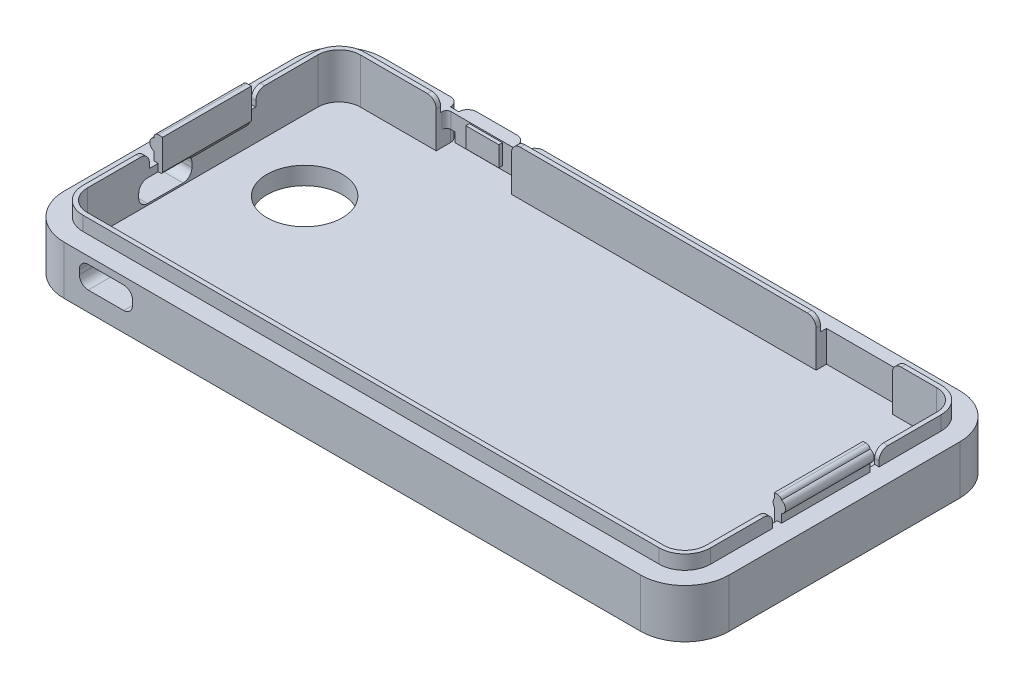
from build123d import *

# Parameters (mm, degrees)
EXTRUDE_2_DEPTH       = 5.5
EXTRUDE_4_DEPTH       = 1.6
SKETCH_7_W            = 0.5
SKETCH_7_H            = 10
EXTRUDE_8_DEPTH       = 2.8
SKETCH_8_R            = 0.7
EXTRUDE_9_DEPTH       = 10
FILLET_1_R            = 0.5
SKETCH_11_W           = 1
SKETCH_11_H           = 1.6
CUT_EXTRUDE_1_DEPTH   = 1.2
FILLET_2_R            = 1
SKETCH_13_W           = 0.5
SKETCH_13_H           = 10
EXTRUDE_10_DEPTH      = 2.8
CUT_EXTRUDE_START     = -3.5
CUT_EXTRUDE_2_DEPTH   = 3.5
SKETCH_13_2_W         = 0.5
SKETCH_13_2_H         = 10
EXTRUDE_11_DEPTH      = 2
EXTRUDE_12_DEPTH      = 1.6
EXTRUDE_12_DEPTH_BACK = 2
SKETCH_5_W            = 0.3
SKETCH_5_H            = 10
SKETCH_17_W           = 0.5
SKETCH_17_H           = 1
CUT_EXTRUDE_3_DEPTH   = 1.6
SKETCH_19_W           = 0.8
SKETCH_19_H           = 10
EXTRUDE_15_DEPTH      = 1
SKETCH_20_R           = 0.7
EXTRUDE_16_DEPTH      = 10
FILLET_4_R            = 0.5
CHAMFER_11_SIZE       = 1
CHAMFER_11_SIZE_2     = 1.37638192
FILLET_5_R            = 1
CUT_EXTRUDE_17_REACH  = 45.451
SKETCH_33_R           = 4.25
SKETCH_44_W           = 0.815007944
SKETCH_44_H           = 4.866639491
CUT_EXTRUDE_19_DEPTH  = 0.5
CUT_EXTRUDE_20_REACH  = 55.751
SKETCH_45_W           = 6
SKETCH_45_H           = 2.5
FILLET_12_R           = 1
SKETCH_46_W           = 8.5
SKETCH_46_H           = 1.2
SKETCH_46_W_2         = 8.6
CUT_EXTRUDE_21_DEPTH  = 5.1
FILLET_13_R           = 1
CUT_EXTRUDE_22_REACH  = 55.751
SKETCH_51_W           = 0.953732737
SKETCH_51_H           = 1.75
CUT_EXTRUDE_23_DEPTH  = 1
FILLET_14_R           = 1
SKETCH_52_W           = 3.721904065
SKETCH_52_H           = 2.260969759
EXTRUDE_18_DEPTH      = 0.4
FILLET_15_R           = 0.5
CUT_EXTRUDE_24_REACH  = 79.575
SKETCH_53_W           = 6
SKETCH_53_H           = 2.5
FILLET_16_R           = 1


# Some blends are built 0.0001 mm under size
with BuildPart() as part:
    # case 2 → 凸台-拉伸2 (new body)
    with BuildSketch(Plane(origin=(0, 0, 0), x_dir=(1, 0, 0), z_dir=(0, 1, 0))):
        with BuildLine():
            Line((-34.042196447, 18), (30.957803553, 18))
            ThreePointArc((30.957803553, 18), (34.493337459, 16.535533906), (35.957803553, 13))
            Line((35.957803553, 13), (35.957803553, -13))
            ThreePointArc((35.957803553, -13), (34.493337459, -16.535533906), (30.957803553, -18))
            Line((30.957803553, -18), (-34.042196447, -18))
            ThreePointArc((-34.042196447, -18), (-37.577730353, -16.535533906), (-39.042196447, -13))
            Line((-39.042196447, -13), (-39.042196447, 13))
            ThreePointArc((-39.042196447, 13), (-37.577730353, 16.535533906), (-34.042196447, 18))
        make_face()
    extrude(amount=EXTRUDE_2_DEPTH)

    # 草图3 → 凸台-拉伸4 (add)
    with BuildSketch(Plane(origin=(0, 5.5, 0), x_dir=(1, 0, 0), z_dir=(0, 1, 0))):
        with BuildLine():
            Line((-36.942196447, 13), (-36.942196447, -13))
            ThreePointArc((-36.942196447, -13), (-36.092806113, -15.050609665), (-34.042196447, -15.9))
            Line((-34.042196447, -15.9), (30.957803553, -15.9))
            ThreePointArc((30.957803553, -15.9), (33.008413218, -15.050609665), (33.857803553, -13))
            Line((33.857803553, -13), (33.857803553, 13))
            ThreePointArc((33.857803553, 13), (33.008413218, 15.050609665), (30.957803553, 15.9))
            Line((30.957803553, 15.9), (-34.042196447, 15.9))
            ThreePointArc((-34.042196447, 15.9), (-36.092806113, 15.050609665), (-36.942196447, 13))
        make_face()
        with BuildLine():
            Line((-34.042196447, -15.4), (30.957803553, -15.4))
            ThreePointArc((30.957803553, -15.4), (32.654859828, -14.697056275), (33.357803553, -13))
            Line((33.357803553, -13), (33.357803553, 13))
            ThreePointArc((33.357803553, 13), (32.654859828, 14.697056275), (30.957803553, 15.4))
            Line((30.957803553, 15.4), (-34.042196447, 15.4))
            ThreePointArc((-34.042196447, 15.4), (-35.739252722, 14.697056275), (-36.442196447, 13))
            Line((-36.442196447, 13), (-36.442196447, -13))
            ThreePointArc((-36.442196447, -13), (-35.739252722, -14.697056275), (-34.042196447, -15.4))
        make_face(mode=Mode.SUBTRACT)
    extrude(amount=EXTRUDE_4_DEPTH)

    # 草图7 → 凸台-拉伸8 (add)
    with BuildSketch(Plane(origin=(0, 5.5, 0), x_dir=(1, 0, 0), z_dir=(0, 1, 0))):
        with Locations((-36.692196447, 0)):
            Rectangle(SKETCH_7_W, SKETCH_7_H)
    extrude(amount=EXTRUDE_8_DEPTH)

    # 草图8 → 凸台-拉伸9 (add)
    with BuildSketch(Plane.XY.offset(5)):
        with Locations((-36.692196447, 7.1)):
            Circle(SKETCH_8_R)
    extrude(amount=-EXTRUDE_9_DEPTH)

    # 圆角1
    fillet_1_edges = [part.edges().sort_by_distance(p)[0] for p in [
        (-36.942196447, 8.3, 0),
    ]]
    fillet(fillet_1_edges, radius=FILLET_1_R - 0.0001)  # a hair under: the kernel refuses the full size

    # 草图11 → 切除-拉伸1 (cut)
    with BuildSketch(Plane.ZY.offset(36.942196447)):
        with Locations((5.5, 6.3)):
            Rectangle(SKETCH_11_W, SKETCH_11_H)
        with Locations((-5.5, 6.3)):
            Rectangle(SKETCH_11_W, SKETCH_11_H)
    extrude(amount=-CUT_EXTRUDE_1_DEPTH, mode=Mode.SUBTRACT)

    # 圆角2
    fillet_2_edges = [part.edges().sort_by_distance(p)[0] for p in [
        (-36.692196447, 7.1, 6),
        (-36.692196447, 7.1, -6),
    ]]
    fillet(fillet_2_edges, radius=FILLET_2_R)

    # 草图13 → 凸台-拉伸10 (add)
    with BuildSketch(Plane(origin=(0, 5.5, 0), x_dir=(1, 0, 0), z_dir=(0, 1, 0))):
        with Locations((-36.192196447, 0)):
            Rectangle(SKETCH_13_W, SKETCH_13_H)
    extrude(amount=EXTRUDE_10_DEPTH)

    # 草图14 → 切除-拉伸2 (cut)
    with BuildSketch(Plane(origin=(0, 5.5, 0), x_dir=(1, 0, 0), z_dir=(0, 1, 0)).offset(CUT_EXTRUDE_START)):
        with BuildLine():
            Line((-34.042196447, -15.4), (30.957803553, -15.4))
            ThreePointArc((30.957803553, -15.4), (32.654859828, -14.697056275), (33.357803553, -13))
            Line((33.357803553, -13), (33.357803553, 13))
            ThreePointArc((33.357803553, 13), (32.654859828, 14.697056275), (30.957803553, 15.4))
            Line((30.957803553, 15.4), (-34.042196447, 15.4))
            ThreePointArc((-34.042196447, 15.4), (-35.739252722, 14.697056275), (-36.442196447, 13))
            Line((-36.442196447, 13), (-36.442196447, -13))
            ThreePointArc((-36.442196447, -13), (-35.739252722, -14.697056275), (-34.042196447, -15.4))
        make_face()
    extrude(amount=CUT_EXTRUDE_2_DEPTH, mode=Mode.SUBTRACT)

    # 草图13<2> → 凸台-拉伸11 (add)
    with BuildSketch(Plane(origin=(0, 5.5, 0), x_dir=(1, 0, 0), z_dir=(0, 1, 0))):
        with Locations((-36.192196447, 0)):
            Rectangle(SKETCH_13_2_W, SKETCH_13_2_H)
    extrude(amount=-EXTRUDE_11_DEPTH)

    # 草图5 → 凸台-拉伸12 (add, two sides: drawn at the far end of the back side and taken through both)
    with BuildSketch(Plane(origin=(0, 5.5, 0), x_dir=(1, 0, 0), z_dir=(0, 1, 0)).offset(-EXTRUDE_12_DEPTH_BACK)):
        with Locations((33.207803553, 0)):
            Rectangle(SKETCH_5_W, SKETCH_5_H)
    extrude(amount=EXTRUDE_12_DEPTH + EXTRUDE_12_DEPTH_BACK)

    # 草图17 → 切除-拉伸3 (cut)
    with BuildSketch(Plane(origin=(0, 7.1, 0), x_dir=(1, 0, 0), z_dir=(0, 1, 0))):
        with Locations((33.607803553, -5.5)):
            Rectangle(SKETCH_17_W, SKETCH_17_H)
        with Locations((33.607803553, 5.5)):
            Rectangle(SKETCH_17_W, SKETCH_17_H)
    extrude(amount=-CUT_EXTRUDE_3_DEPTH, mode=Mode.SUBTRACT)

    # 草图19 → 凸台-拉伸15 (add)
    with BuildSketch(Plane(origin=(0, 7.1, 0), x_dir=(1, 0, 0), z_dir=(0, 1, 0))):
        with Locations((33.457803553, 0)):
            Rectangle(SKETCH_19_W, SKETCH_19_H)
    extrude(amount=EXTRUDE_15_DEPTH)

    # 草图20 → 凸台-拉伸16 (add)
    with BuildSketch(Plane(origin=(0, 0, -5), x_dir=(-1, 0, 0), z_dir=(0, 0, -1))):
        with Locations((-33.607803553, 7.1)):
            Circle(SKETCH_20_R)
    extrude(amount=-EXTRUDE_16_DEPTH)

    # 圆角4
    # the kernel refuses this fillet: 0.5 mm, written as the material it takes off along each edge
    with BuildSketch(Plane(origin=(33.857803553, 8.1, -6.189366537), x_dir=(-1, 0, 0), z_dir=(0, 0, 1))) as fillet_4_piece_1:
        with BuildLine():
            CenterArc((0.475746615, 0.5), FILLET_4_R, 197.918850754, 72.081149246)
            Line((0, 0.346165158), (-0.009514932, 0.343088462))
            ThreePointArc((-0.009514932, 0.343088462), (-0.01, 0.173082579), (-0.01, 0))
            Line((-0.01, 0), (0, -0.01))
            Line((0, -0.01), (0.475746615, -0.01))
            Line((0.475746615, -0.01), (0.475746615, 0))
        make_face()
    extrude(amount=12.378733074, mode=Mode.SUBTRACT)

    # 倒角11
    # the kernel refuses this chamfer: 1.37638192, 1 mm, written as the material it takes off along each edge
    with BuildSketch(Plane(origin=(-35.942196447, 3.5, 8.553227563), x_dir=(-0.9990705747005859, -0.04310437063037643, 0), z_dir=(0, 0, -1))) as chamfer_11_piece_1_section:
        Polygon((CHAMFER_11_SIZE * 0.999070574701, CHAMFER_11_SIZE * 0.0431043706304), (-CHAMFER_11_SIZE_2 * 0.0431043706451, CHAMFER_11_SIZE_2 * 0.999070575043), (0, 0), align=None)
    chamfer_11_piece_1 = extrude(amount=17.106455125, mode=Mode.PRIVATE)
    chamfer_11_piece_1 = split(chamfer_11_piece_1, bisect_by=Plane(origin=(-36.442196447, 4.046250957, 0), z_dir=(1, 0, 0)), keep=Keep.TOP, mode=Mode.PRIVATE)
    add(chamfer_11_piece_1, mode=Mode.SUBTRACT)

    # 圆角5
    fillet_5_edges = [part.edges().sort_by_distance(p)[0] for p in [
        (33.607803553, 7.1, 6),
        (33.607803553, 7.1, -6),
    ]]
    fillet(fillet_5_edges, radius=FILLET_5_R)

    # 草图33 → 切除-拉伸17 (cut, up to next)
    with BuildSketch(Plane(origin=(0, 2, 0), x_dir=(1, 0, 0), z_dir=(0, 1, 0)), mode=Mode.PRIVATE) as cut_extrude_17_sk1:
        with Locations(Location((-28.50055533, 3.570643202, 0), (0, 0, 270))):
            Circle(SKETCH_33_R)
    cut_extrude_17_tool1 = extrude(cut_extrude_17_sk1.sketch, amount=-CUT_EXTRUDE_17_REACH, mode=Mode.PRIVATE) & part.part
    add(cut_extrude_17_tool1.solids().sort_by_distance((-28.500555, 2, -3.570643))[0], mode=Mode.SUBTRACT)

    # 草图44 → 切除-拉伸19 (cut)
    # profile 1 of 9: a face of its own
    with BuildSketch(Plane.XZ):
        with BuildLine():
            Line((-7.930682984, 5.508242812), (-8.751256022, 5.981240978))
            Line((-8.751256022, 5.981240978), (-13.008135173, 8.437360216))
            Line((-13.008135173, 8.437360216), (-13.828708211, 8.916062603))
            add(Edge.make_bspline(
                [(-13.828708211, 8.916062603), (-14.0965979, 9.064198436), (-14.392869565, 9.143987964), (-14.689210794, 9.143987964)],
                knots=[3, 3, 3, 3, 4, 4, 4, 4], degree=3))
            add(Edge.make_bspline(
                [(-14.689210794, 9.143987964), (-14.985552024, 9.143987964), (-15.281893253, 9.064198436), (-15.549713378, 8.916062603)],
                knots=[4, 4, 4, 4, 5, 5, 5, 5], degree=3))
            Line((-15.549713378, 8.916062603), (-16.370355979, 8.437360216))
            Line((-16.370355979, 8.437360216), (-20.627235131, 5.981240978))
            Line((-20.627235131, 5.981240978), (-21.447877732, 5.508242812))
            add(Edge.make_bspline(
                [(-21.447877732, 5.508242812), (-21.977813761, 5.200527923), (-22.308380316, 4.630662348), (-22.308380316, 4.020902009)],
                knots=[8, 8, 8, 8, 9, 9, 9, 9], degree=3))
            Line((-22.308380316, 4.020902009), (-22.308380316, -2.794702792))
            add(Edge.make_bspline(
                [(-22.308380316, -2.794702792), (-22.308380316, -3.41013257), (-21.977813761, -3.974328706), (-21.447877732, -4.282043595)],
                knots=[10, 10, 10, 10, 11, 11, 11, 11], degree=3))
            Line((-21.447877732, -4.282043595), (-20.627235131, -4.755041762))
            Line((-20.627235131, -4.755041762), (-16.370355979, -7.211160999))
            Line((-16.370355979, -7.211160999), (-15.549713378, -7.689828605))
            add(Edge.make_bspline(
                [(-15.549713378, -7.689828605), (-15.281893253, -7.84370344), (-14.985552024, -7.917788748), (-14.689210794, -7.917788748)],
                knots=[14, 14, 14, 14, 15, 15, 15, 15], degree=3))
            add(Edge.make_bspline(
                [(-14.689210794, -7.917788748), (-14.392869565, -7.917788748), (-14.0965979, -7.84370344), (-13.828708211, -7.689828605)],
                knots=[15, 15, 15, 15, 16, 16, 16, 16], degree=3))
            Line((-13.828708211, -7.689828605), (-13.008135173, -7.211160999))
            Line((-13.008135173, -7.211160999), (-8.751256022, -4.755041762))
            Line((-8.751256022, -4.755041762), (-7.930682984, -4.282043595))
            add(Edge.make_bspline(
                [(-7.930682984, -4.282043595), (-7.394973171, -3.974328706), (-7.070180401, -3.41013257), (-7.070180401, -2.794702792)],
                knots=[19, 19, 19, 19, 20, 20, 20, 20], degree=3))
            Line((-7.070180401, -2.794702792), (-7.070180401, 4.020902009))
            add(Edge.make_bspline(
                [(-7.070180401, 4.020902009), (-7.070180401, 4.630662348), (-7.394973171, 5.200527923), (-7.930682984, 5.508242812)],
                knots=[21, 21, 21, 21, 22, 22, 22, 22], degree=3))
        make_face()
        with BuildLine():
            Line((-20.353710785, 4.830101386), (-15.088158435, 7.873198862))
            add(Edge.make_bspline(
                [(-15.088158435, 7.873198862), (-14.84308563, 8.015665256), (-14.535335959, 8.015665256), (-14.284628496, 7.873198862)],
                knots=[3, 3, 3, 3, 4, 4, 4, 4], degree=3))
            Line((-14.284628496, 7.873198862), (-9.047597251, 4.824397165))
            add(Edge.make_bspline(
                [(-9.047597251, 4.824397165), (-8.779777126, 4.670557112), (-8.774072905, 4.283052695), (-9.04189303, 4.123473638)],
                knots=[5, 5, 5, 5, 6, 6, 6, 6], degree=3))
            Line((-9.04189303, 4.123473638), (-14.130753661, 1.080410945))
            add(Edge.make_bspline(
                [(-14.130753661, 1.080410945), (-14.472728657, 0.880937124), (-14.900127838, 0.880937124), (-15.242033271, 1.080410945)],
                knots=[7, 7, 7, 7, 8, 8, 8, 8], degree=3))
            add(Edge.make_bspline(
                [(-15.242033271, 1.080410945), (-20.393570767, 4.055092552), (-20.404979209, 4.060796773)],
                knots=[0, 0, 0, 1, 1, 1], degree=2))
            add(Edge.make_bspline(
                [(-20.404979209, 4.060796773), (-20.672799334, 4.25453159), (-20.644347793, 4.664852891), (-20.353710785, 4.830101386)],
                knots=[1, 1, 1, 1, 2, 2, 2, 2], degree=3))
        make_face(mode=Mode.SUBTRACT)
        with BuildLine():
            Line((-12.552214888, -4.076900336), (-13.144897346, -4.407397327))
            Line((-13.144897346, -4.407397327), (-13.144897346, -3.324673603))
            Line((-13.144897346, -3.324673603), (-12.620665538, -3.062522917))
            add(Edge.make_bspline(
                [(-11.663260763, -1.677753743), (-11.663260763, -2.219132996), (-11.970940871, -2.697800601), (-12.620665538, -3.062522917)],
                knots=[0, 0, 0, 0, 1, 1, 1, 1], degree=3))
            add(Edge.make_bspline(
                [(-12.654821299, -1.489688364), (-12.016574638, -1.125000831), (-11.663260763, -1.11929661), (-11.663260763, -1.677753743)],
                knots=[6, 6, 6, 6, 7, 7, 7, 7], degree=3))
            Line((-12.654821299, -1.489688364), (-13.144897346, -1.763247492))
            add(Edge.make_bspline(
                [(-13.201939555, -1.860114901), (-13.201939555, -1.820220137), (-13.179122671, -1.780325373), (-13.144897346, -1.763247492)],
                knots=[4, 4, 4, 4, 5, 5, 5, 5], degree=3))
            Line((-13.201939555, -1.860114901), (-13.201939555, -3.204989311))
            Line((-13.201939555, -3.204989311), (-13.201939555, -4.504299517))
            Line((-13.201939555, -4.504299517), (-13.201939555, -6.213896243))
            add(Edge.make_bspline(
                [(-13.201939555, -6.213896243), (-13.201939555, -6.253791007), (-13.218982653, -6.28798155), (-13.258842636, -6.310763652)],
                knots=[3, 3, 3, 3, 4, 4, 4, 4], degree=3))
            Line((-13.258842636, -6.310763652), (-14.364418025, -6.937601872))
            add(Edge.make_bspline(
                [(-14.364418025, -6.937601872), (-14.438503332, -6.977496636), (-14.529701302, -6.926228212), (-14.529701302, -6.840734463)],
                knots=[5, 5, 5, 5, 6, 6, 6, 6], degree=3))
            Line((-14.529701302, -6.840734463), (-14.529701302, -1.563773672))
            add(Edge.make_bspline(
                [(-14.529701302, -1.563773672), (-14.529701302, -1.523878908), (-14.512588639, -1.483984144), (-14.472728657, -1.466906263)],
                knots=[7, 7, 7, 7, 8, 8, 8, 8], degree=3))
            Line((-14.472728657, -1.466906263), (-12.592144434, -0.40126042))
            add(Edge.make_bspline(
                [(-12.592144434, -0.40126042), (-11.372623755, 0.288289448), (-10.36402012, 0.42505162), (-10.36402012, -0.942639673)],
                knots=[9, 9, 9, 9, 10, 10, 10, 10], degree=3))
            add(Edge.make_bspline(
                [(-10.36402012, -0.942639673), (-10.36402012, -2.25902776), (-11.384032197, -3.415836791), (-12.552214888, -4.076900336)],
                knots=[10, 10, 10, 10, 11, 11, 11, 11], degree=3))
        make_face(mode=Mode.SUBTRACT)
        with BuildLine():
            Line((-8.648719174, -3.723586462), (-9.742816558, -4.344720461))
            add(Edge.make_bspline(
                [(-9.742816558, -4.344720461), (-9.816901865, -4.384615225), (-9.908099835, -4.333312019), (-9.908099835, -4.247853052)],
                knots=[2, 2, 2, 2, 3, 3, 3, 3], degree=3))
            Line((-9.908099835, -4.247853052), (-9.908099835, -1.734726388))
            add(Edge.make_bspline(
                [(-9.908099835, -1.734726388), (-9.908099835, -1.694866406), (-9.885282951, -1.660641081), (-9.851057626, -1.637858979)],
                knots=[4, 4, 4, 4, 5, 5, 5, 5], degree=3))
            Line((-9.851057626, -1.637858979), (-8.756960243, -1.022394419))
            add(Edge.make_bspline(
                [(-8.756960243, -1.022394419), (-8.682874936, -0.982534437), (-8.591676966, -1.033802861), (-8.591676966, -1.11929661)],
                knots=[6, 6, 6, 6, 7, 7, 7, 7], degree=3))
            Line((-8.591676966, -1.11929661), (-8.591676966, -3.626684271))
            add(Edge.make_bspline(
                [(-8.591676966, -3.626684271), (-8.591676966, -3.666579035), (-8.614493849, -3.706473799), (-8.648719174, -3.723586462)],
                knots=[0, 0, 0, 0, 1, 1, 1, 1], degree=3))
        make_face(mode=Mode.SUBTRACT)
        with BuildLine():
            add(Edge.make_bspline(
                [(-9.24703629, 0.647307542), (-8.808228667, 0.898049787), (-8.494844339, 0.789773936), (-8.494844339, 0.390861077), (-8.494844339, -0.002347561), (-8.808228667, -0.463937286), (-9.24703629, -0.708975309)],
                knots=[2, 2, 2, 2, 3, 3, 3, 4, 4, 4, 4], degree=3))
            add(Edge.make_bspline(
                [(-9.24703629, -0.708975309), (-9.69147857, -0.965421774), (-10.004932462, -0.857145924), (-10.004932462, -0.463937286), (-10.004932462, -0.059320206), (-9.69147857, 0.396565298), (-9.24703629, 0.647307542)],
                knots=[0, 0, 0, 0, 1, 1, 1, 2, 2, 2, 2], degree=3))
        make_face(mode=Mode.SUBTRACT)
    # profile 2 of 9: a face of its own
    with BuildSketch(Plane.XZ):
        with BuildLine():
            Line((-3.075417154, 3.542199621), (-4.950297156, 3.542199621))
            Line((-4.950297156, 3.542199621), (-4.950297156, -3.022628153))
            Line((-4.950297156, -3.022628153), (-4.118246113, -3.022628153))
            Line((-4.118246113, -3.022628153), (-4.118246113, -0.418338301))
            Line((-4.118246113, -0.418338301), (-3.029783387, -0.418338301))
            add(Edge.make_bspline(
                [(-3.029783387, -0.418338301), (-1.599415228, -0.418338301), (-0.613558913, 0.231282021), (-0.613558913, 1.616085977)],
                knots=[5, 5, 5, 5, 6, 6, 6, 6], degree=3))
            add(Edge.make_bspline(
                [(-0.613558913, 1.616085977), (-0.613558913, 3.052123574), (-1.599415228, 3.542199621), (-3.075417154, 3.542199621)],
                knots=[6, 6, 6, 6, 7, 7, 7, 7], degree=3))
        make_face()
        with BuildLine():
            Line((-3.138024456, 0.254098904), (-4.118246113, 0.254098904))
            Line((-4.118246113, 0.254098904), (-4.118246113, 2.869762416))
            Line((-4.118246113, 2.869762416), (-3.172249781, 2.869762416))
            add(Edge.make_bspline(
                [(-3.172249781, 2.869762416), (-2.021110189, 2.869762416), (-1.439836172, 2.567751748), (-1.439836172, 1.616085977)],
                knots=[3, 3, 3, 3, 4, 4, 4, 4], degree=3))
            add(Edge.make_bspline(
                [(-1.439836172, 1.616085977), (-1.439836172, 0.675793865), (-1.981250206, 0.254098904), (-3.138024456, 0.254098904)],
                knots=[4, 4, 4, 4, 5, 5, 5, 5], degree=3))
        make_face(mode=Mode.SUBTRACT)
    # profile 3 of 9: a face of its own
    with BuildSketch(Plane.XZ):
        with Locations((0.87092978, -0.589308408)):
            Rectangle(SKETCH_44_W, SKETCH_44_H)
    # profile 4 of 9: a face of its own
    with BuildSketch(Plane.XZ):
        with BuildLine():
            Line((5.985459404, 0.766957053), (5.153477925, 1.097488825))
            add(Edge.make_bspline(
                [(5.153477925, 1.097488825), (4.566499687, 1.331153189), (4.144804727, 1.473619583), (4.144804727, 1.844011338)],
                knots=[1, 1, 1, 1, 2, 2, 2, 2], degree=3))
            add(Edge.make_bspline(
                [(4.144804727, 1.844011338), (4.144804727, 2.197325212), (4.446850177, 2.396799032), (4.942630445, 2.396799032)],
                knots=[2, 2, 2, 2, 3, 3, 3, 3], degree=3))
            add(Edge.make_bspline(
                [(4.942630445, 2.396799032), (5.461158032, 2.396799032), (5.871514115, 2.220142095), (6.310252174, 1.883906102)],
                knots=[3, 3, 3, 3, 4, 4, 4, 4], degree=3))
            Line((6.310252174, 1.883906102), (7.108147456, 2.886875079))
            add(Edge.make_bspline(
                [(7.108147456, 2.886875079), (6.526873439, 3.473818535), (5.711935058, 3.770159764), (4.942630445, 3.770159764)],
                knots=[5, 5, 5, 5, 6, 6, 6, 6], degree=3))
            add(Edge.make_bspline(
                [(4.942630445, 3.770159764), (3.523670727, 3.770159764), (2.52070175, 2.869762416), (2.52070175, 1.75284815)],
                knots=[6, 6, 6, 6, 7, 7, 7, 7], degree=3))
            add(Edge.make_bspline(
                [(2.52070175, 1.75284815), (2.52070175, 0.784069715), (3.175991511, 0.202795699), (3.876984602, -0.076432868)],
                knots=[7, 7, 7, 7, 8, 8, 8, 8], degree=3))
            Line((3.876984602, -0.076432868), (4.726078743, -0.435450963))
            add(Edge.make_bspline(
                [(4.726078743, -0.435450963), (5.295944319, -0.674784766), (5.666370855, -0.800173279), (5.666370855, -1.187677696)],
                knots=[9, 9, 9, 9, 10, 10, 10, 10], degree=3))
            add(Edge.make_bspline(
                [(5.666370855, -1.187677696), (5.666370855, -1.546695791), (5.387142288, -1.768916931), (4.79445983, -1.768916931)],
                knots=[10, 10, 10, 10, 11, 11, 11, 11], degree=3))
            add(Edge.make_bspline(
                [(4.79445983, -1.768916931), (4.270228021, -1.768916931), (3.649024459, -1.489688364), (3.175991511, -1.085106066)],
                knots=[11, 11, 11, 11, 12, 12, 12, 12], degree=3))
            Line((3.175991511, -1.085106066), (2.269994288, -2.190646674))
            add(Edge.make_bspline(
                [(2.269994288, -2.190646674), (2.959509373, -2.823189114), (3.8940277, -3.148016666), (4.760234505, -3.148016666)],
                knots=[13, 13, 13, 13, 14, 14, 14, 14], degree=3))
            add(Edge.make_bspline(
                [(4.760234505, -3.148016666), (6.372998603, -3.148016666), (7.307516931, -2.173534011), (7.307516931, -1.062289183)],
                knots=[14, 14, 14, 14, 15, 15, 15, 15], degree=3))
            add(Edge.make_bspline(
                [(7.307516931, -1.062289183), (7.307516931, -0.122031853), (6.811806226, 0.436460062), (5.985459404, 0.766957053)],
                knots=[15, 15, 15, 15, 16, 16, 16, 16], degree=3))
        make_face()
    # profile 5 of 9: a face of its own
    with BuildSketch(Plane.XZ):
        with BuildLine():
            Line((11.091502261, 2.07197148), (11.091502261, -1.267467224))
            add(Edge.make_bspline(
                [(11.091502261, -1.267467224), (10.823682136, -1.6435632), (10.60135665, -1.786029594), (10.242408119, -1.786029594)],
                knots=[1, 1, 1, 1, 2, 2, 2, 2], degree=3))
            add(Edge.make_bspline(
                [(10.242408119, -1.786029594), (9.837756257, -1.786029594), (9.649725661, -1.586590555), (9.649725661, -0.879928025)],
                knots=[2, 2, 2, 2, 3, 3, 3, 3], degree=3))
            Line((9.649725661, -0.879928025), (9.649725661, 2.07197148))
            Line((9.649725661, 2.07197148), (8.059778445, 2.07197148))
            Line((8.059778445, 2.07197148), (8.059778445, -1.079401846))
            add(Edge.make_bspline(
                [(8.059778445, -1.079401846), (8.074880978, -2.350101203), (8.557362179, -3.142248877), (9.66849375, -3.129042841)],
                knots=[6, 6, 6, 6, 7, 7, 7, 7], degree=3))
            add(Edge.make_bspline(
                [(9.66849375, -3.129042841), (10.363664205, -3.137284367), (10.846218425, -2.818154864), (11.273828637, -2.321704626)],
                knots=[7, 7, 7, 7, 8, 8, 8, 8], degree=3))
            Line((11.273828637, -2.321704626), (11.38784349, -3.022628153))
            Line((11.38784349, -3.022628153), (12.687084133, -3.022628153))
            Line((12.687084133, -3.022628153), (12.687084133, 2.07197148))
            Line((12.687084133, 2.07197148), (11.091502261, 2.07197148))
        make_face()
    # profile 6 of 9: a face of its own
    with BuildSketch(Plane.XZ):
        with BuildLine():
            Line((16.539380986, -2.019659176), (15.735851048, -2.019659176))
            add(Edge.make_bspline(
                [(15.735851048, -2.019659176), (15.188802356, -2.019659176), (14.983659096, -1.911383325), (14.983659096, -1.677753743)],
                knots=[1, 1, 1, 1, 2, 2, 2, 2], degree=3))
            add(Edge.make_bspline(
                [(14.983659096, -1.677753743), (14.983659096, -1.506801027), (15.023519079, -1.427011499), (15.143168589, -1.318735648)],
                knots=[2, 2, 2, 2, 3, 3, 3, 3], degree=3))
            add(Edge.make_bspline(
                [(15.143168589, -1.318735648), (15.365494075, -1.381412514), (15.57056777, -1.409933618), (15.741555268, -1.409933618)],
                knots=[3, 3, 3, 3, 4, 4, 4, 4], degree=3))
            add(Edge.make_bspline(
                [(15.741555268, -1.409933618), (16.869877977, -1.409933618), (17.776014327, -0.891336467), (17.776014327, 0.299663107)],
                knots=[4, 4, 4, 4, 5, 5, 5, 5], degree=3))
            add(Edge.make_bspline(
                [(17.776014327, 0.299663107), (17.776014327, 0.544735913), (17.713267898, 0.778365495), (17.633547934, 0.920831888)],
                knots=[5, 5, 5, 5, 6, 6, 6, 6], degree=3))
            Line((17.633547934, 0.920831888), (18.419895646, 0.920831888))
            Line((18.419895646, 0.920831888), (18.419895646, 2.07197148))
            Line((18.419895646, 2.07197148), (16.550789428, 2.07197148))
            add(Edge.make_bspline(
                [(16.550789428, 2.07197148), (16.317125064, 2.157430448), (16.037896498, 2.197325212), (15.741555268, 2.197325212)],
                knots=[9, 9, 9, 9, 10, 10, 10, 10], degree=3))
            add(Edge.make_bspline(
                [(15.741555268, 2.197325212), (14.64182818, 2.184522898), (13.617439541, 1.568500577), (13.63196705, 0.320578133)],
                knots=[10, 10, 10, 10, 11, 11, 11, 11], degree=3))
            add(Edge.make_bspline(
                [(13.63196705, 0.320578133), (13.618800558, -0.27192327), (13.938777212, -0.752148689), (14.292066562, -1.010803587)],
                knots=[11, 11, 11, 11, 12, 12, 12, 12], degree=3))
            add(Edge.make_bspline(
                [(14.292066562, -1.010803587), (13.961569571, -1.244433169), (13.727905207, -1.603451264), (13.727905207, -1.962469358)],
                knots=[13, 13, 13, 13, 14, 14, 14, 14], degree=3))
            add(Edge.make_bspline(
                [(13.727905207, -1.962469358), (13.727905207, -2.38986854), (13.92741381, -2.657723447), (14.195233935, -2.840084605)],
                knots=[14, 14, 14, 14, 15, 15, 15, 15], degree=3))
            add(Edge.make_bspline(
                [(14.195233935, -2.840084605), (13.727633398, -3.089898989), (13.484580594, -3.437287664), (13.493945343, -3.858878628)],
                knots=[16, 16, 16, 16, 17, 17, 17, 17], degree=3))
            add(Edge.make_bspline(
                [(13.493945343, -3.858878628), (13.483562463, -4.770590516), (14.442321182, -5.151959738), (15.616201537, -5.165328281)],
                knots=[17, 17, 17, 17, 18, 18, 18, 18], degree=3))
            add(Edge.make_bspline(
                [(15.616201537, -5.165328281), (17.388475128, -5.165328281), (18.499754738, -4.401727888), (18.499754738, -3.324673603)],
                knots=[18, 18, 18, 18, 19, 19, 19, 19], degree=3))
            add(Edge.make_bspline(
                [(18.499754738, -3.324673603), (18.499754738, -2.401494154), (17.79312699, -2.019659176), (16.539380986, -2.019659176)],
                knots=[19, 19, 19, 19, 20, 20, 20, 20], degree=3))
        make_face()
        with BuildLine():
            Line((15.75296371, -3.239179854), (16.2374051, -3.239179854))
            add(Edge.make_bspline(
                [(16.2374051, -3.239179854), (16.710298921, -3.239179854), (16.97818861, -3.30185672), (16.97818861, -3.60390217)],
                knots=[4, 4, 4, 4, 5, 5, 5, 5], degree=3))
            add(Edge.make_bspline(
                [(16.97818861, -3.60390217), (16.97818861, -3.928729721), (16.522337888, -4.168063524), (15.866909, -4.168063524)],
                knots=[5, 5, 5, 5, 6, 6, 6, 6], degree=3))
            add(Edge.make_bspline(
                [(15.866909, -4.168063524), (15.211619239, -4.168063524), (14.784220058, -3.991406587), (14.784220058, -3.632388492)],
                knots=[0, 0, 0, 0, 1, 1, 1, 1], degree=3))
            add(Edge.make_bspline(
                [(14.784220058, -3.632388492), (14.784220058, -3.461435776), (14.863940022, -3.318969382), (15.023519079, -3.176502988)],
                knots=[1, 1, 1, 1, 2, 2, 2, 2], degree=3))
            add(Edge.make_bspline(
                [(15.023519079, -3.176502988), (15.188802356, -3.222101973), (15.382606737, -3.239179854), (15.75296371, -3.239179854)],
                knots=[2, 2, 2, 2, 3, 3, 3, 3], degree=3))
        make_face(mode=Mode.SUBTRACT)
        with BuildLine():
            add(Edge.make_bspline(
                [(15.741555268, -0.452528844), (15.376902516, -0.452528844), (15.09767395, -0.184708719), (15.09767395, 0.345262092), (15.09767395, 0.863859244), (15.376902516, 1.131679369), (15.741555268, 1.131679369)],
                knots=[2, 2, 2, 2, 3, 3, 3, 4, 4, 4, 4], degree=3))
            add(Edge.make_bspline(
                [(15.741555268, 1.131679369), (16.117686026, 1.131679369), (16.385506151, 0.863859244), (16.385506151, 0.345262092), (16.385506151, -0.184708719), (16.117686026, -0.452528844), (15.741555268, -0.452528844)],
                knots=[0, 0, 0, 0, 1, 1, 1, 2, 2, 2, 2], degree=3))
        make_face(mode=Mode.SUBTRACT)
    # profile 7 of 9: a face of its own
    with BuildSketch(Plane.XZ):
        with BuildLine():
            Line((18.875815932, 1.530592228), (19.434273065, 0.482024265))
            add(Edge.make_bspline(
                [(19.434273065, 0.482024265), (19.941531339, 0.766957053), (20.363226299, 0.926536109), (20.767808597, 0.926536109)],
                knots=[2, 2, 2, 2, 3, 3, 3, 3], degree=3))
            add(Edge.make_bspline(
                [(20.767808597, 0.926536109), (21.286336185, 0.926536109), (21.502957449, 0.687202307), (21.537113211, 0.276881006)],
                knots=[3, 3, 3, 3, 4, 4, 4, 4], degree=3))
            add(Edge.make_bspline(
                [(21.537113211, 0.276881006), (19.548287919, 0.060329305), (18.704828434, -0.52090993), (18.704828434, -1.597964215)],
                knots=[4, 4, 4, 4, 5, 5, 5, 5], degree=3))
            add(Edge.make_bspline(
                [(18.704828434, -1.597964215), (18.704828434, -2.447058357), (19.28039823, -3.148016666), (20.220759905, -3.148016666)],
                knots=[5, 5, 5, 5, 6, 6, 6, 6], degree=3))
            add(Edge.make_bspline(
                [(20.220759905, -3.148016666), (20.78492126, -3.148016666), (21.257884644, -2.88586598), (21.679579605, -2.509770004)],
                knots=[6, 6, 6, 6, 7, 7, 7, 7], degree=3))
            Line((21.679579605, -2.509770004), (21.833384876, -3.022628153))
            Line((21.833384876, -3.022628153), (23.132695083, -3.022628153))
            Line((23.132695083, -3.022628153), (23.132695083, -0.127736074))
            add(Edge.make_bspline(
                [(23.132695083, -0.127736074), (23.132695083, 1.467915362), (22.386207353, 2.197325212), (21.069854047, 2.197325212)],
                knots=[11, 11, 11, 11, 12, 12, 12, 12], degree=3))
            add(Edge.make_bspline(
                [(21.069854047, 2.197325212), (20.277662986, 2.197325212), (19.548287919, 1.929505087), (18.875815932, 1.530592228)],
                knots=[0, 0, 0, 0, 1, 1, 1, 1], degree=3))
        make_face()
        with BuildLine():
            Line((21.537113211, -0.691897428), (21.537113211, -1.506801027))
            add(Edge.make_bspline(
                [(21.537113211, -1.506801027), (21.303448847, -1.757543271), (21.092601367, -1.911383325), (20.767808597, -1.911383325)],
                knots=[0, 0, 0, 0, 1, 1, 1, 1], degree=3))
            add(Edge.make_bspline(
                [(20.767808597, -1.911383325), (20.437242043, -1.911383325), (20.220759905, -1.768916931), (20.220759905, -1.472610484)],
                knots=[1, 1, 1, 1, 2, 2, 2, 2], degree=3))
            add(Edge.make_bspline(
                [(20.220759905, -1.472610484), (20.220759905, -1.113592389), (20.545552675, -0.828659601), (21.537113211, -0.691897428)],
                knots=[2, 2, 2, 2, 3, 3, 3, 3], degree=3))
        make_face(mode=Mode.SUBTRACT)
    # profile 8 of 9: a face of its own
    with BuildSketch(Plane.XZ):
        with BuildLine():
            Line((25.623074428, 1.188686795), (25.480608034, 2.07197148))
            Line((25.480608034, 2.07197148), (24.181297827, 2.07197148))
            Line((24.181297827, 2.07197148), (24.181297827, -3.022628153))
            Line((24.181297827, -3.022628153), (25.765540821, -3.022628153))
            Line((25.765540821, -3.022628153), (25.765540821, -0.110623411))
            add(Edge.make_bspline(
                [(25.765540821, -0.110623411), (26.033360947, 0.561813793), (26.489281232, 0.801147596), (26.865342426, 0.801147596)],
                knots=[7, 7, 7, 7, 8, 8, 8, 8], degree=3))
            add(Edge.make_bspline(
                [(26.865342426, 0.801147596), (27.093302569, 0.801147596), (27.241473183, 0.766957053), (27.423799559, 0.72139285)],
                knots=[8, 8, 8, 8, 9, 9, 9, 9], degree=3))
            Line((27.423799559, 0.72139285), (27.691619684, 2.094753582))
            add(Edge.make_bspline(
                [(27.691619684, 2.094753582), (27.549153291, 2.157430448), (27.378235356, 2.197325212), (27.076189906, 2.197325212)],
                knots=[10, 10, 10, 10, 11, 11, 11, 11], degree=3))
            add(Edge.make_bspline(
                [(27.076189906, 2.197325212), (26.563296976, 2.197325212), (25.999135621, 1.866793439), (25.623074428, 1.188686795)],
                knots=[0, 0, 0, 0, 1, 1, 1, 1], degree=3))
        make_face()
    # profile 9 of 9: a face of its own
    with BuildSketch(Plane.XZ):
        with BuildLine():
            add(Edge.make_bspline(
                [(0.87378189, 2.846980315), (1.19857466, 2.846980315), (1.437943245, 3.069236237), (1.437943245, 3.371246905), (1.437943245, 3.707482899), (1.19857466, 3.901217716), (0.87378189, 3.901217716)],
                knots=[2, 2, 2, 2, 3, 3, 3, 4, 4, 4, 4], degree=3))
            add(Edge.make_bspline(
                [(0.87378189, 3.901217716), (0.54898912, 3.901217716), (0.309620536, 3.707482899), (0.309620536, 3.371246905), (0.309620536, 3.069236237), (0.54898912, 2.846980315), (0.87378189, 2.846980315)],
                knots=[0, 0, 0, 0, 1, 1, 1, 2, 2, 2, 2], degree=3))
        make_face()
    extrude(amount=-CUT_EXTRUDE_19_DEPTH, mode=Mode.SUBTRACT)

    # 草图45 → 切除-拉伸20 (cut, up to next)
    with BuildSketch(Plane.XY.offset(18), mode=Mode.PRIVATE) as cut_extrude_20_sk1:
        with Locations((-29.34055533, 3.434330293)):
            Rectangle(SKETCH_45_W, SKETCH_45_H)
    cut_extrude_20_tool1 = extrude(cut_extrude_20_sk1.sketch, amount=-CUT_EXTRUDE_20_REACH, mode=Mode.PRIVATE) & part.part
    add(cut_extrude_20_tool1.solids().sort_by_distance((-29.340555, 3.43433, 18))[0], mode=Mode.SUBTRACT)

    # 圆角12
    fillet_12_edges = [part.edges().sort_by_distance(p)[0] for p in [
        (-26.34055533, 4.684330293, 16.7),
        (-26.34055533, 2.184330293, 16.7),
        (-32.34055533, 2.184330293, 16.7),
        (-32.34055533, 4.684330293, 16.7),
    ]]
    fillet(fillet_12_edges, radius=FILLET_12_R)

    # 草图46 → 切除-拉伸21 (cut)
    with BuildSketch(Plane(origin=(0, 7.1, 0), x_dir=(1, 0, 0), z_dir=(0, 1, 0))):
        with Locations((-21.240555327, 15.970643202)):
            Rectangle(SKETCH_46_W, SKETCH_46_H)
        with Locations((21.657803553, 15.970643202)):
            Rectangle(SKETCH_46_W_2, SKETCH_46_H)
    extrude(amount=-CUT_EXTRUDE_21_DEPTH, mode=Mode.SUBTRACT)

    # 圆角13
    fillet_13_edges = [part.edges().sort_by_distance(p)[0] for p in [
        (-25.490555327, 7.1, -15.65),
        (-16.990555327, 7.1, -15.65),
        (17.357803553, 7.1, -15.65),
        (25.957803553, 7.1, -15.65),
    ]]
    fillet(fillet_13_edges, radius=FILLET_13_R)

    # 草图49 → 切除-拉伸22 (cut, up to next)
    with BuildSketch(Plane(origin=(0, 0, -18), x_dir=(-1, 0, 0), z_dir=(0, 0, -1)), mode=Mode.PRIVATE) as cut_extrude_22_sk1:
        Polygon((25.490555327, 3.75), (24.53682259, 3.75), (24.53682259, 2.684330293), (17.982996507, 2.684330293), (17.982996507, 5.5), (16.990555327, 5.5), (16.990555327, 2), (25.490555327, 2), align=None)
    cut_extrude_22_tool1 = extrude(cut_extrude_22_sk1.sketch, amount=-CUT_EXTRUDE_22_REACH, mode=Mode.PRIVATE) & part.part
    add(cut_extrude_22_tool1.solids().sort_by_distance((-25.013689, 3.658076, -18))[0], mode=Mode.SUBTRACT)

    # 草图51 → 切除-拉伸23 (cut)
    with BuildSketch(Plane(origin=(0, 0, -18), x_dir=(-1, 0, 0), z_dir=(0, 0, -1))):
        with Locations((25.013688959, 4.625)):
            Rectangle(SKETCH_51_W, SKETCH_51_H)
    extrude(amount=-CUT_EXTRUDE_23_DEPTH, mode=Mode.SUBTRACT)

    # 圆角14
    fillet_14_edges = [part.edges().sort_by_distance(p)[0] for p in [
        (-17.982996507, 4.092165146, -18),
        (-24.53682259, 4.092165146, -18),
        (-25.490555327, 3.75, -18),
        (-16.990555327, 3.75, -18),
    ]]
    fillet(fillet_14_edges, radius=FILLET_14_R - 0.0001)  # a hair under: the kernel refuses the full size

    # 草图52 → 凸台-拉伸18 (add)
    with BuildSketch(Plane.XY.offset(-16.570643202)):
        with Locations((-21.061963332, 4.228243871)):
            Rectangle(SKETCH_52_W, SKETCH_52_H)
    extrude(amount=EXTRUDE_18_DEPTH)

    # 圆角15
    fillet_15_edges = [part.edges().sort_by_distance(p)[0] for p in [
        (-25.490555327, 4.625, -16.570643202),
    ]]
    fillet(fillet_15_edges, radius=FILLET_15_R)

    # 草图53 → 切除-拉伸24 (cut, up to next)
    with BuildSketch(Plane.ZY.offset(39.042196447), mode=Mode.PRIVATE) as cut_extrude_24_sk1:
        with Locations((4.2, 3.434330293)):
            Rectangle(SKETCH_53_W, SKETCH_53_H)
    cut_extrude_24_tool1 = extrude(cut_extrude_24_sk1.sketch, amount=-CUT_EXTRUDE_24_REACH, mode=Mode.PRIVATE) & part.part
    add(cut_extrude_24_tool1.solids().sort_by_distance((-39.042196, 3.43433, 4.2))[0], mode=Mode.SUBTRACT)

    # 圆角16
    fillet_16_edges = [part.edges().sort_by_distance(p)[0] for p in [
        (-37.742196447, 4.684330293, 7.2),
        (-37.561963285, 4.684330293, 1.2),
        (-37.742196447, 2.184330293, 1.2),
        (-37.742196447, 2.184330293, 7.2),
    ]]
    fillet(fillet_16_edges, radius=FILLET_16_R)


solid = part.part
